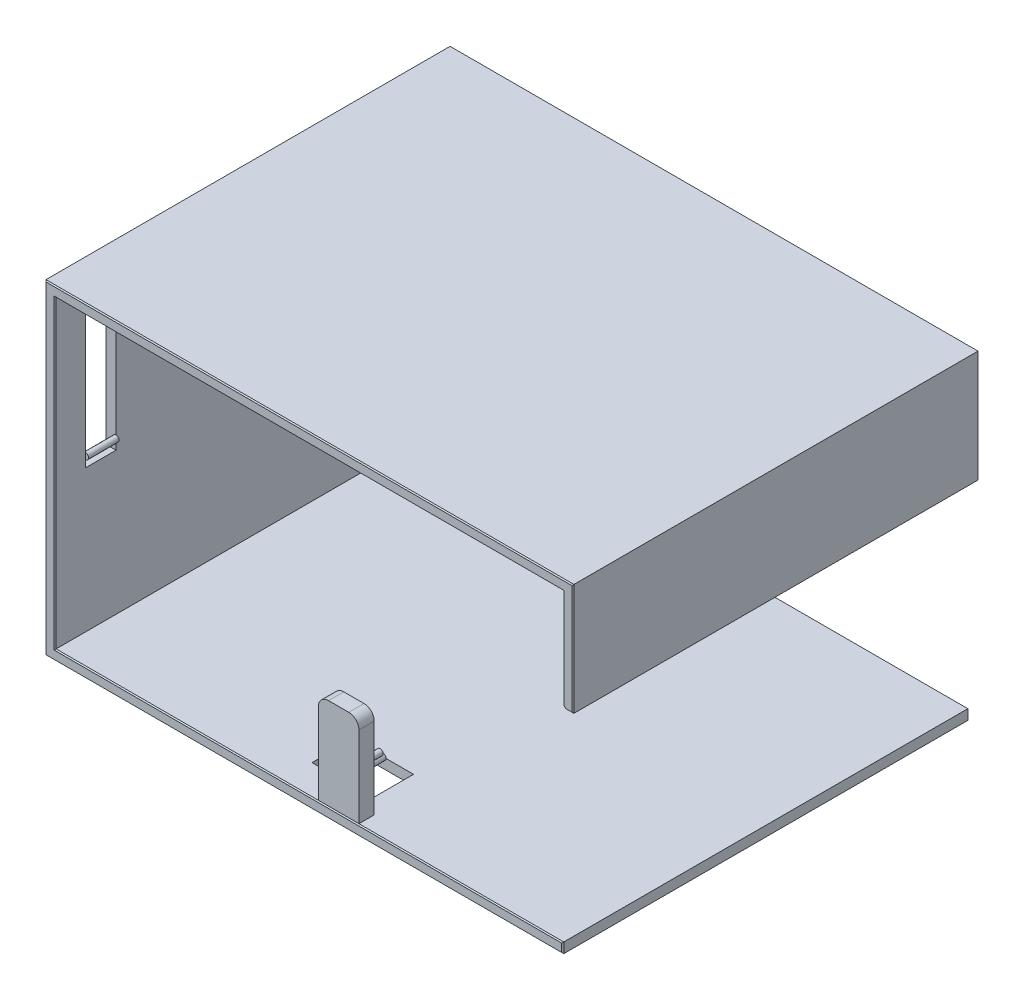
from build123d import *

# Parameters (mm, degrees)
BOSS_EXTRUDE1_DEPTH  = 2000
SKETCH4_W            = 600
SKETCH4_H            = 400
CUT_EXTRUDE1_DEPTH   = 4514.313638559
BOSS_EXTRUDE5_START  = 1300
SKETCH5_R            = 30
BOSS_EXTRUDE5_DEPTH  = 400
BOSS_EXTRUDE6_START  = -1700
SKETCH5_2_R          = 30
BOSS_EXTRUDE6_DEPTH  = 400
SKETCH6_W            = 300
SKETCH6_H            = 1600
CUT_EXTRUDE2_DEPTH   = 5708.013229352
BOSS_EXTRUDE7_START  = -1400
SKETCH7_R            = 30
BOSS_EXTRUDE7_DEPTH  = 300
BOSS_EXTRUDE8_START  = 1700
SKETCH7_2_R          = 30
BOSS_EXTRUDE8_DEPTH  = 300
SKETCH10_W           = 1500
SKETCH10_H           = 100
BOSS_EXTRUDE9_DEPTH  = 1000
CHAMFER1_SIZE        = 10
SKETCH12_W           = 400
SKETCH12_H           = 150
BOSS_EXTRUDE10_DEPTH = 900
FILLET4_R            = 100
BOSS_EXTRUDE11_START = 1575
SKETCH13_R           = 30
BOSS_EXTRUDE11_DEPTH = 265
BOSS_EXTRUDE12_START = -1840
SKETCH13_2_R         = 30
BOSS_EXTRUDE12_DEPTH = 265
CHAMFER4_SIZE        = 40


with BuildPart() as part:
    # Sketch1 → Boss-Extrude1 (new, symmetric)
    with BuildSketch(Plane.XY):
        Polygon((2500, -1500), (-2500, -1500), (-2500, 700), (-2500, 1500), (2500, 1500), (2500, 500), (2600, 500), (2600, 1600), (-2600, 1600), (-2600, -1600), (2500, -1600), align=None)
    extrude(amount=BOSS_EXTRUDE1_DEPTH, both=True)

    # Sketch4 → Cut-Extrude1 (cut, through all)
    with BuildSketch(Plane(origin=(0, -1500, 0), x_dir=(1, 0, 0), z_dir=(0, 1, 0))):
        with Locations((30, -1500)):
            Rectangle(SKETCH4_W, SKETCH4_H)
        with Locations((30, 1500)):
            Rectangle(SKETCH4_W, SKETCH4_H)
    extrude(amount=-CUT_EXTRUDE1_DEPTH, mode=Mode.SUBTRACT)

    # Sketch5 → Boss-Extrude5 (add)
    with BuildSketch(Plane.XY.offset(BOSS_EXTRUDE5_START)):
        with Locations(Location((30, -1500, 0), (0, 0, 180))):
            Circle(SKETCH5_R)
    extrude(amount=BOSS_EXTRUDE5_DEPTH)

    # Sketch5<2> → Boss-Extrude6 (add)
    with BuildSketch(Plane.XY.offset(BOSS_EXTRUDE6_START)):
        with Locations(Location((30, -1500, 0), (0, 0, 180))):
            Circle(SKETCH5_2_R)
    extrude(amount=BOSS_EXTRUDE6_DEPTH)

    # Sketch6 → Cut-Extrude2 (cut, through all)
    with BuildSketch(Plane(origin=(-2500, 0, 0), x_dir=(0, 0, -1), z_dir=(1, 0, 0))):
        with Locations((-1550, 700)):
            Rectangle(SKETCH6_W, SKETCH6_H)
        with Locations((1550, 700)):
            Rectangle(SKETCH6_W, SKETCH6_H)
    extrude(amount=-CUT_EXTRUDE2_DEPTH, mode=Mode.SUBTRACT)

    # Sketch7 → Boss-Extrude7 (add)
    with BuildSketch(Plane.XY.offset(BOSS_EXTRUDE7_START)):
        with Locations(Location((-2500, 0, 0), (0, 0, 90))):
            Circle(SKETCH7_R)
    extrude(amount=-BOSS_EXTRUDE7_DEPTH)

    # Sketch7<2> → Boss-Extrude8 (add)
    with BuildSketch(Plane.XY.offset(BOSS_EXTRUDE8_START)):
        with Locations(Location((-2500, 0, 0), (0, 0, 90))):
            Circle(SKETCH7_2_R)
    extrude(amount=-BOSS_EXTRUDE8_DEPTH)

    # Sketch10 → Boss-Extrude9 (add, symmetric)
    with BuildSketch(Plane.XY):
        with Locations((-1750, 690)):
            Rectangle(SKETCH10_W, SKETCH10_H)
    extrude(amount=BOSS_EXTRUDE9_DEPTH, both=True)

    # Chamfer1
    chamfer1_edges = [part.edges().sort_by_distance(p)[0] for p in [
        (2500, -1550, -2000),
        (-50, -1600, -2000),
        (-2600, 0, -2000),
        (0, 1600, -2000),
        (2600, 1050, -2000),
        (2550, 500, -2000),
        (2500, 1000, -2000),
        (-1000, 640, 0),
        (-1750, 740, -1000),
        (-1000, 740, 0),
        (-2500, 690, -1000),
        (-2500, 740, 0),
        (0, 1500, -2000),
        (-1750, 640, -1000),
        (-2500, 640, 0),
        (-1750, 740, 1000),
        (0, 1500, 2000),
        (-2500, 690, 1000),
        (-1750, 640, 1000),
        (-2500, 0, -2000),
        (0, -1500, -2000),
        (2500, 1000, 2000),
        (2550, 500, 2000),
        (2600, 1050, 2000),
        (0, 1600, 2000),
        (-2600, 0, 2000),
        (-50, -1600, 2000),
        (2500, -1550, 2000),
        (0, -1500, 2000),
        (-2500, 0, 2000),
    ]]
    chamfer(chamfer1_edges, length=CHAMFER1_SIZE)

    # Sketch12 → Boss-Extrude10 (add)
    with BuildSketch(Plane(origin=(0, -1500, 0), x_dir=(1, 0, 0), z_dir=(0, 1, 0))):
        with Locations((282.5, -1915)):
            Rectangle(SKETCH12_W, SKETCH12_H)
        with Locations((282.5, 1915)):
            Rectangle(SKETCH12_W, SKETCH12_H)
    extrude(amount=BOSS_EXTRUDE10_DEPTH)

    # Fillet4
    fillet4_edges = [part.edges().sort_by_distance(p)[0] for p in [
        (482.5, -600, 1915),
        (82.5, -600, 1915),
        (82.5, -600, -1915),
        (482.5, -600, -1915),
    ]]
    fillet(fillet4_edges, radius=FILLET4_R)

    # Sketch13 → Boss-Extrude11 (add)
    with BuildSketch(Plane.XY.offset(BOSS_EXTRUDE11_START)):
        with Locations(Location((276.56, -1200, 0), (0, 0, 180))):
            Circle(SKETCH13_R)
    extrude(amount=BOSS_EXTRUDE11_DEPTH)

    # Sketch13<2> → Boss-Extrude12 (add)
    with BuildSketch(Plane.XY.offset(BOSS_EXTRUDE12_START)):
        with Locations(Location((276.56, -1200, 0), (0, 0, 180))):
            Circle(SKETCH13_2_R)
    extrude(amount=BOSS_EXTRUDE12_DEPTH)

    # Chamfer4
    # the kernel refuses this chamfer: 40 mm, written as the material it takes off along each edge
    with BuildSketch(Plane(origin=(2500, 500, -2092.867319519), x_dir=(-0.02749587661058214, 0.9996219169112969, 0), z_dir=(0, 0, 1))) as chamfer4_piece_1:
        Polygon((CHAMFER4_SIZE * 0.999621916911, -CHAMFER4_SIZE * 0.0274958766106), (-CHAMFER4_SIZE * 0.0274958766106, -CHAMFER4_SIZE * 0.999621916911), (0, 0), align=None)
    extrude(amount=4185.734639037, mode=Mode.SUBTRACT)


solid = part.part
